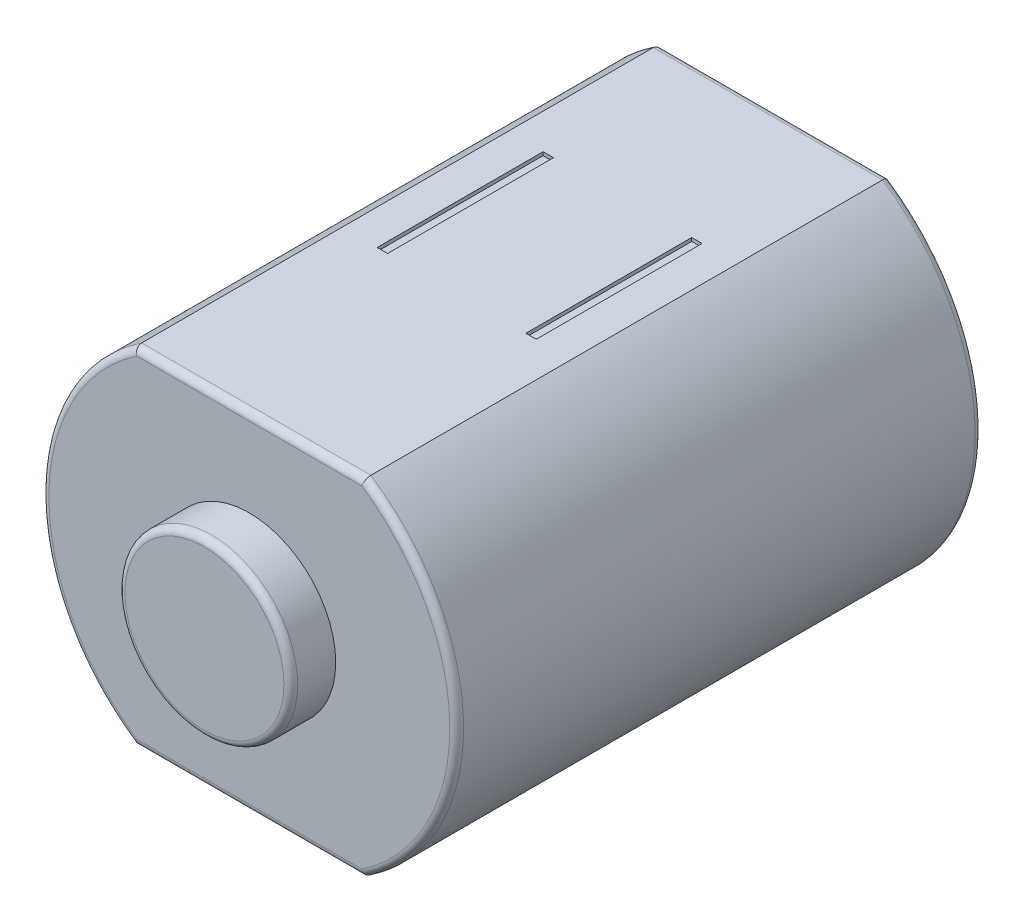
from build123d import *

# Parameters (mm, degrees)
AUFSATZ_LINEAR_AUSTRAGEN1_DEPTH = 15.2
SKIZZE2_R                       = 2.5
AUFSATZ_LINEAR_AUSTRAGEN2_DEPTH = 1.3
SKIZZE3_R                       = 0.5
AUFSATZ_LINEAR_AUSTRAGEN3_DEPTH = 2
VERRUNDUNG1_R                   = 0.2
SKIZZE4_W                       = 0.3
SKIZZE4_H                       = 4.8
SCHNITT_LINEAR_AUSTRAGEN1_DEPTH = 0.1


with BuildPart() as part:
    # Skizze1 → Aufsatz-Linear austragen1 (new body)
    with BuildSketch(Plane.XY):
        with BuildLine():
            Line((-3.31662479, 5), (3.31662479, 5))
            ThreePointArc((3.31662479, 5), (6, 0), (3.31662479, -5))
            Line((3.31662479, -5), (-3.31662479, -5))
            ThreePointArc((-3.31662479, -5), (-6, 0), (-3.31662479, 5))
        make_face()
    extrude(amount=AUFSATZ_LINEAR_AUSTRAGEN1_DEPTH)

    # Skizze2 → Aufsatz-Linear austragen2 (add)
    with BuildSketch(Plane.XY.offset(15.2)):
        Circle(SKIZZE2_R)
    extrude(amount=AUFSATZ_LINEAR_AUSTRAGEN2_DEPTH)

    # Skizze3 → Aufsatz-Linear austragen3 (add)
    with BuildSketch(Plane(origin=(0, 0, 0), x_dir=(-1, 0, 0), z_dir=(0, 0, -1))):
        Circle(SKIZZE3_R)
    extrude(amount=AUFSATZ_LINEAR_AUSTRAGEN3_DEPTH)

    # Verrundung1
    verrundung1_edges = [part.edges().sort_by_distance(p)[0] for p in [
        (-2.5, 0, 16.5),
        (0, 5, 15.2),
        (6, 0, 15.2),
        (0, -5, 15.2),
        (-6, 0, 15.2),
        (0, -5, 0),
        (-6, 0, 0),
        (0, 5, 0),
        (6, 0, 0),
    ]]
    fillet(verrundung1_edges, radius=VERRUNDUNG1_R)

    # Skizze4 → Schnitt-Linear austragen1 (cut)
    with BuildSketch(Plane(origin=(0, 5, 0), x_dir=(1, 0, 0), z_dir=(0, 1, 0))):
        with Locations((-2.15, -6.8)):
            Rectangle(SKIZZE4_W, SKIZZE4_H)
        with Locations((2.15, -6.8)):
            Rectangle(SKIZZE4_W, SKIZZE4_H)
    schnitt_linear_austragen1 = extrude(amount=-SCHNITT_LINEAR_AUSTRAGEN1_DEPTH, mode=Mode.SUBTRACT)

    # Spiegeln1: Schnitt-Linear austragen1 across plane
    add(schnitt_linear_austragen1.mirror(Plane.ZX), mode=Mode.SUBTRACT)


solid = part.part
